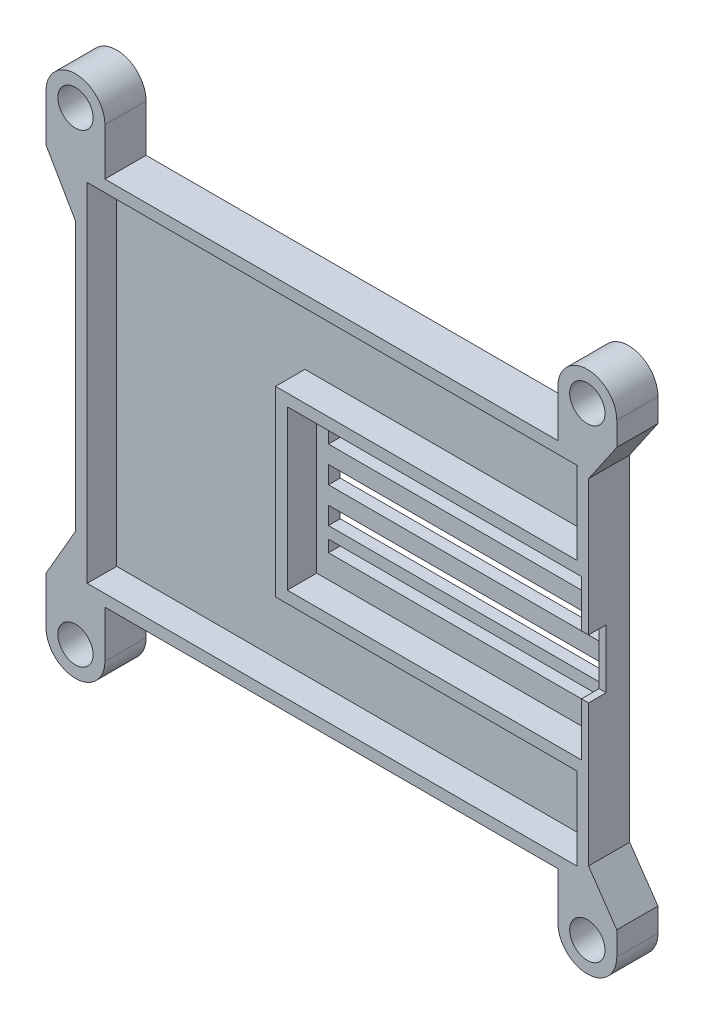
from build123d import *

# Parameters (mm, degrees)
EXTRUDE_1_DEPTH          = 2
SKETCH_3_W               = 50
SKETCH_3_H               = 27
EXTRUDE_2_DEPTH          = 5
SKETCH_5_R               = 3
CUT_EXTRUDE_1_DEPTH      = 5
SKETCH_6_W               = 3
SKETCH_6_H               = 10
CUT_EXTRUDE_2_DEPTH      = 102.540368708
CUT_EXTRUDE_5_DEPTH      = 69.047384059
CUT_EXTRUDE_5_DEPTH_BACK = 69.047384059
CUT_EXTRUDE_6_DEPTH      = 5
SKETCH_11_W              = 46
SKETCH_11_H              = 3
SKETCH_11_H_2            = 2
CUT_EXTRUDE_8_DEPTH      = 10
SKETCH_14_R              = 2
CUT_EXTRUDE_9_DEPTH      = 10


with BuildPart() as part:
    # 草图1 → 凸台-拉伸1 (new body)
    with BuildSketch(Plane.XY):
        with BuildLine():
            Line((-46, 22.841953517), (-46, -22.841953517))
            Line((-46, -22.841953517), (-51, -31.502207555))
            Line((-51, -31.502207555), (-51, -39.502207555))
            ThreePointArc((-51, -39.502207555), (-46, -44.502207555), (-41, -39.502207555))
            Line((-41, -39.502207555), (-41, -31.502207555))
            Line((-41, -31.502207555), (36, -31.502207555))
            Line((36, -31.502207555), (36, -39.502207555))
            ThreePointArc((36, -39.502207555), (41, -44.502207555), (46, -39.502207555))
            Line((46, -39.502207555), (46, 39.502207555))
            ThreePointArc((46, 39.502207555), (41, 44.502207555), (36, 39.502207555))
            Line((36, 39.502207555), (36, 31.502207555))
            Line((36, 31.502207555), (-41, 31.502207555))
            Line((-41, 31.502207555), (-41, 39.502207555))
            ThreePointArc((-41, 39.502207555), (-46, 44.502207555), (-51, 39.502207555))
            Line((-51, 39.502207555), (-51, 31.502207555))
            Line((-51, 31.502207555), (-46, 22.841953517))
        make_face()
    extrude(amount=EXTRUDE_1_DEPTH)

    # 草图3 → 凸台-拉伸2 (add)
    with BuildSketch(Plane.XY.offset(2)):
        with BuildLine():
            Line((-51, 39.502207555), (-51, 31.502207555))
            Line((-51, 31.502207555), (-46, 22.841953517))
            Line((-46, 22.841953517), (-46, -22.841953517))
            Line((-46, -22.841953517), (-51, -31.502207555))
            Line((-51, -31.502207555), (-51, -39.502207555))
            ThreePointArc((-51, -39.502207555), (-46, -44.502207555), (-41, -39.502207555))
            Line((-41, -39.502207555), (-41, -31.502207555))
            Line((-41, -31.502207555), (36, -31.502207555))
            Line((36, -31.502207555), (36, -39.502207555))
            ThreePointArc((36, -39.502207555), (41, -44.502207555), (46, -39.502207555))
            Line((46, -39.502207555), (46, 39.502207555))
            ThreePointArc((46, 39.502207555), (41, 44.502207555), (36, 39.502207555))
            Line((36, 39.502207555), (36, 31.502207555))
            Line((36, 31.502207555), (-41, 31.502207555))
            Line((-41, 31.502207555), (-41, 39.502207555))
            ThreePointArc((-41, 39.502207555), (-46, 44.502207555), (-51, 39.502207555))
        make_face()
        with Locations((15, 0)):
            Rectangle(SKETCH_3_W, SKETCH_3_H, mode=Mode.SUBTRACT)
    extrude(amount=EXTRUDE_2_DEPTH)

    # 草图5 → 切除-拉伸1 (cut)
    with BuildSketch(Plane.XY.offset(7)):
        with Locations((41, 39.502207555)):
            Circle(SKETCH_5_R)
        with Locations((-46, 39.502207555)):
            Circle(SKETCH_5_R)
        with Locations((41, -39.502207555)):
            Circle(SKETCH_5_R)
        with Locations((-46, -39.502207555)):
            Circle(SKETCH_5_R)
    extrude(amount=-CUT_EXTRUDE_1_DEPTH, mode=Mode.SUBTRACT)

    # 草图6 → 切除-拉伸2 (cut, through all)
    with BuildSketch(Plane.ZY.offset(-40)):
        with Locations((5.5, 0.5)):
            Rectangle(SKETCH_6_W, SKETCH_6_H)
    extrude(amount=-CUT_EXTRUDE_2_DEPTH, mode=Mode.SUBTRACT)

    # 草图8 → 切除-拉伸5 (cut, two sides: drawn at the far end of the back side and taken through both)
    with BuildSketch(Plane.XY.offset(7).offset(-CUT_EXTRUDE_5_DEPTH_BACK)):
        Polygon((193.870571144, -251.146790474), (46, -35.502207555), (41.2, -28.502207555), (41.2, 28.502207555), (46, 35.502207555), (193.870571144, 251.146790474), (716.817191567, 251.146790474), (716.817191567, -251.146790474), align=None)
    extrude(amount=CUT_EXTRUDE_5_DEPTH + CUT_EXTRUDE_5_DEPTH_BACK, mode=Mode.SUBTRACT)

    # 草图9 → 切除-拉伸6 (cut)
    with BuildSketch(Plane.XY.offset(7)):
        Polygon((39.2, 15.5), (39.2, 29.502207555), (-44, 29.502207555), (-44, -29.502207555), (39.2, -29.502207555), (39.2, -15.5), (-12, -15.5), (-12, 15.5), align=None)
    extrude(amount=-CUT_EXTRUDE_6_DEPTH, mode=Mode.SUBTRACT)

    # 草图11 → 切除-拉伸8 (cut)
    with BuildSketch(Plane.XY.offset(2)):
        with Locations((15, 8)):
            Rectangle(SKETCH_11_W, SKETCH_11_H)
        with Locations((15, 2)):
            Rectangle(SKETCH_11_W, SKETCH_11_H)
        with Locations((15, -4)):
            Rectangle(SKETCH_11_W, SKETCH_11_H)
        with Locations((15, -8.5)):
            Rectangle(SKETCH_11_W, SKETCH_11_H_2)
    extrude(amount=-CUT_EXTRUDE_8_DEPTH, mode=Mode.SUBTRACT)

    # 草图14 → 切除-拉伸9 (cut)
    with BuildSketch(Plane.XY.offset(2)):
        with Locations((41, -39.502207555)):
            Circle(SKETCH_14_R)
        with Locations((41, 39.502207555)):
            Circle(SKETCH_14_R)
        with Locations((-46, 39.502207555)):
            Circle(SKETCH_14_R)
        with Locations((-46, -39.502207555)):
            Circle(SKETCH_14_R)
    extrude(amount=-CUT_EXTRUDE_9_DEPTH, mode=Mode.SUBTRACT)


solid = part.part
